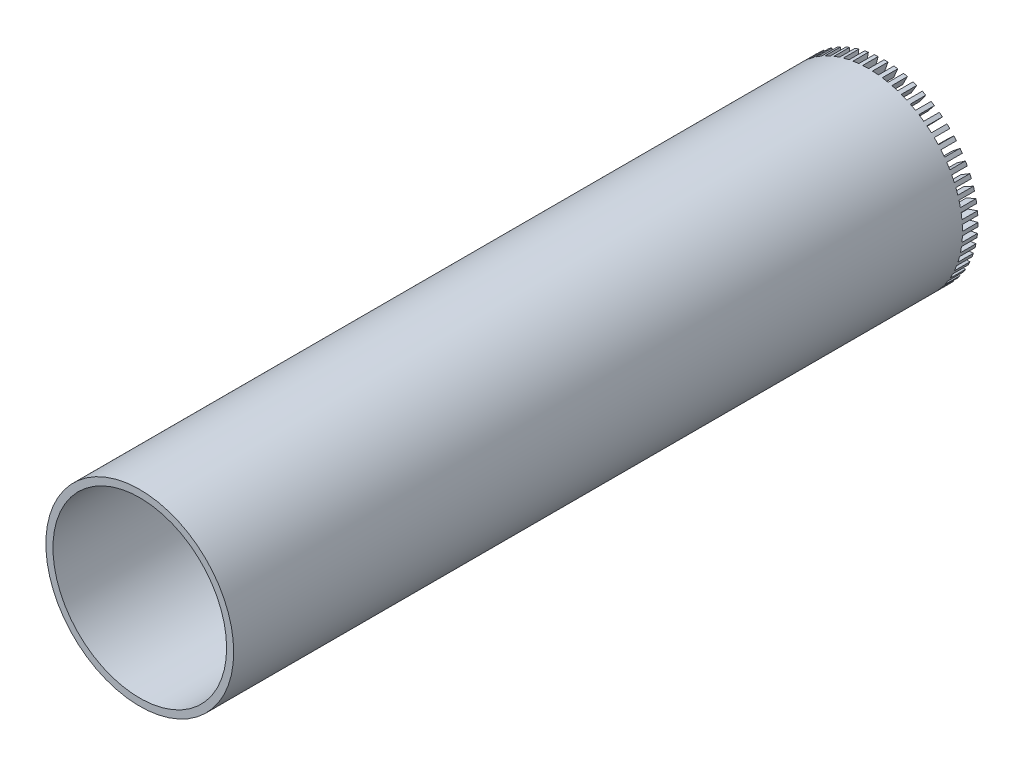
from build123d import *

# Parameters (mm, degrees)
SKETCH1_R           = 23.85
SKETCH1_R_2         = 22.05
BOSS_EXTRUDE4_DEPTH = 189
CUT_EXTRUDE2_START  = -10
SKETCH5_W           = 1.5
SKETCH5_H           = 3.95
CUT_EXTRUDE2_DEPTH  = 202.986054181
CIRPATTERN1_COUNT   = 60
CUT_EXTRUDE10_DEPTH = 1.5
CIRPATTERN7_COUNT   = 60


with BuildPart() as part:
    # Sketch1 → Boss-Extrude4 (new body)
    with BuildSketch(Plane.XY):
        Circle(SKETCH1_R)
        Circle(SKETCH1_R_2, mode=Mode.SUBTRACT)
    extrude(amount=BOSS_EXTRUDE4_DEPTH)

    # Sketch5 → Cut-Extrude2 (cut)
    with BuildSketch(Plane(origin=(0, 0, 0), x_dir=(1, 0, 0), z_dir=(0, 1, 0)).offset(CUT_EXTRUDE2_START)):
        with Locations((-0.75, -1.975)):
            Rectangle(SKETCH5_W, SKETCH5_H)
    cut_extrude2 = extrude(amount=CUT_EXTRUDE2_DEPTH, mode=Mode.SUBTRACT)

    # CirPattern1: Cut-Extrude2 ×60 about axis
    cirpattern1_axis = Axis((0, 0, 189), (0, 0, -1))
    for i in range(1, CIRPATTERN1_COUNT):
        add(cut_extrude2.rotate(cirpattern1_axis, i * 360 / CIRPATTERN1_COUNT), mode=Mode.SUBTRACT)

    # Sketch19 → Cut-Extrude10 (cut)
    with BuildSketch(Plane(origin=(0, 0, 0), x_dir=(0, 0, -1), z_dir=(1, 0, 0))):
        Polygon((-3.95, 23.829182007), (-6.685040212, 16.314720784), (-2.331794806, 16.051019161), (3.052650549, 20.786305557), align=None)
    cut_extrude10 = extrude(amount=-CUT_EXTRUDE10_DEPTH, mode=Mode.SUBTRACT)

    # CirPattern7: Cut-Extrude10 ×60 about axis
    cirpattern7_axis = Axis((0, 0, 189), (0, 0, -1))
    for i in range(1, CIRPATTERN7_COUNT):
        add(cut_extrude10.rotate(cirpattern7_axis, i * 360 / CIRPATTERN7_COUNT), mode=Mode.SUBTRACT)

    # Sketch21 → Cut-Revolve1 (revolve, cut)
    with BuildSketch(Plane(origin=(0, 0, 0), x_dir=(0, 0, -1), z_dir=(1, 0, 0))):
        Polygon((0, 23.853500961), (-1.667164603, 19.273003861), (5.760887888, 22.849174396), align=None)
    revolve(axis=Axis((0, 0, 189), (0, 0, -1)), mode=Mode.SUBTRACT)


solid = part.part
